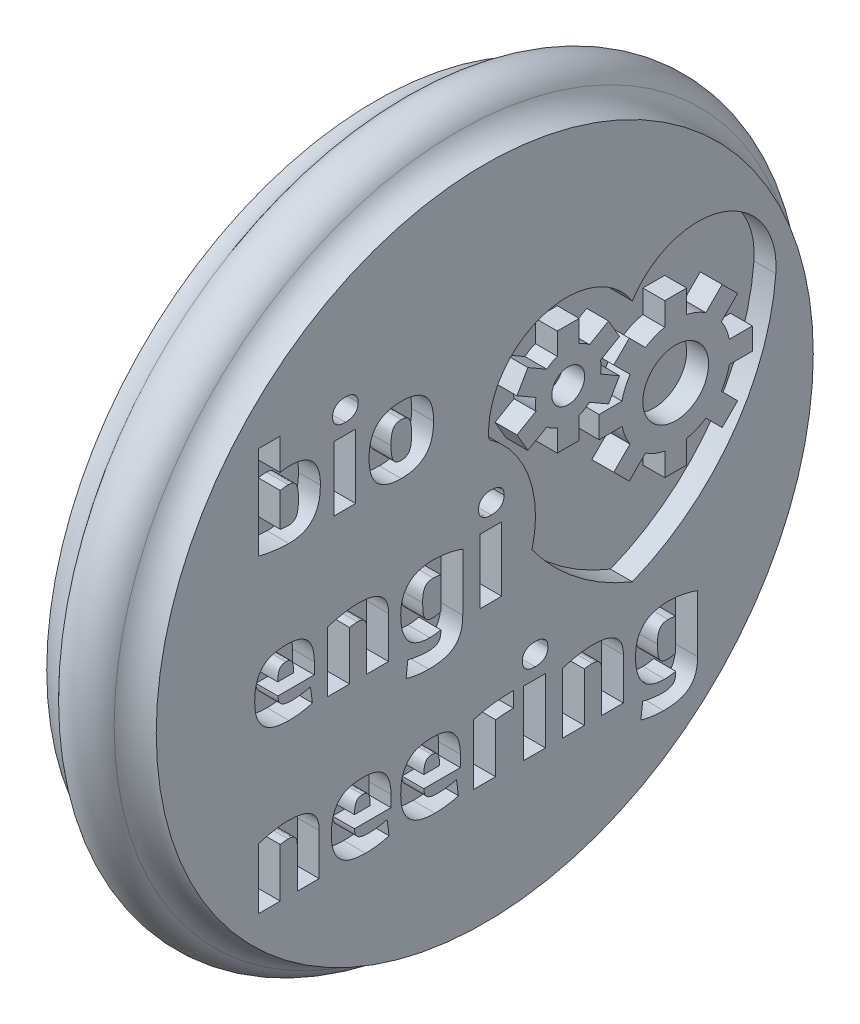
from build123d import *

# Parameters (mm, degrees)
SKETCH4_W           = 1.098925117
SKETCH4_H           = 1.442867679
SKETCH4_W_2         = 3.727396223
SKETCH4_H_2         = 4.327211873
CUT_EXTRUDE1_DEPTH  = 1
SKETCH5_W           = 1
SKETCH5_H           = 2.944444445
CUT_EXTRUDE2_DEPTH  = 1
CUT_EXTRUDE3_DEPTH  = 1
SKETCH12_R          = 1.5
SKETCH12_R_2        = 0.75
BOSS_EXTRUDE6_DEPTH = 1


with BuildPart() as part:
    # Sketch3 → Revolve1 (revolve)
    with BuildSketch(Plane.XY):
        with BuildLine():
            Line((2.5, 0), (2.5, 15))
            ThreePointArc((2.5, 15), (1.790681417, 15.178308982), (1.25, 15.670843802))
            ThreePointArc((1.25, 15.670843802), (0, 16.341687605), (-1.25, 15.670843802))
            ThreePointArc((-1.25, 15.670843802), (-1.790681417, 15.178308982), (-2.5, 15))
            Line((-2.5, 15), (-2.5, 0))
            Line((-2.5, 0), (2.5, 0))
        make_face()
    revolve(axis=Axis((-2.5, 0, 0), (1, 0, 0)))

    # Sketch4 → Cut-Extrude1 (cut)
    # profile 1 of 7: a face of its own
    with BuildSketch(Plane.ZY.offset(2.5)):
        Polygon((-10.653443, 2.733564563), (-9.578232551, 1.753928377), (-4.775625879, 1.753928377), (-4.775625879, 8.063920985), (-5.850836328, 8.063920985), (-5.850836328, 2.732988099), (-9.578232551, 2.732988099), (-9.578232551, 8.063920985), (-10.653443, 8.063920985), align=None)
    # profile 2 of 7: a face of its own
    with BuildSketch(Plane.ZY.offset(2.5)):
        Polygon((-2.923928472, 2.710878701), (-1.87361714, 1.753928377), (2.720938275, 1.753928377), (2.720938275, 2.732988099), (-1.825003355, 2.732988099), (-1.825003355, 8.063920985), (-2.923928472, 8.063920985), align=None)
    # profile 3 of 7: a face of its own
    with BuildSketch(Plane.ZY.offset(2.5)):
        with Locations((-2.374465913, 10.292120608)):
            Rectangle(SKETCH4_W, SKETCH4_H)
    # profile 4 of 7: a face of its own
    with BuildSketch(Plane.ZY.offset(2.5)):
        Polygon((5.246491774, 8.063920985), (4.197699102, 7.096005876), (4.197699102, 2.732988099), (5.246491774, 1.753928377), (10.053458187, 1.753928377), (10.053458187, 2.732988099), (5.246491774, 2.732988099), (5.246491774, 7.096005876), (10.053458187, 7.096005876), (10.053458187, 8.063920985), align=None)
    # profile 5 of 7: a face of its own
    with BuildSketch(Plane.ZY.offset(2.5)):
        Polygon((-2.090431232, -2.863271218), (-3.139223904, -3.831186327), (-3.139223904, -8.194204104), (-2.090431232, -9.173263826), (2.716535182, -9.173263826), (2.716535182, -8.194204104), (-2.090431232, -8.194204104), (-2.090431232, -3.831186327), (2.716535182, -3.831186327), (2.716535182, -2.863271218), align=None)
    # profile 6 of 7: a face of its own
    with BuildSketch(Plane.ZY.offset(2.5)):
        Polygon((-10.653443, 0.058805426), (-10.653443, -8.194204104), (-9.578232551, -9.186499785), (-5.850836328, -9.186499785), (-4.775625879, -8.194204104), (-4.775625879, -3.866992231), (-5.850836328, -2.863271218), (-9.578232551, -2.863271218), (-9.578232551, 0.058805426), align=None)
        with Locations((-7.71453444, -6.030598168)):
            Rectangle(SKETCH4_W_2, SKETCH4_H_2, mode=Mode.SUBTRACT)
    # profile 7 of 7: a face of its own
    with BuildSketch(Plane.ZY.offset(2.5)):
        Polygon((4.197699102, -9.173263826), (4.197699102, -2.860006343), (8.943177617, -2.860006343), (10.053458187, -3.888706099), (10.053458187, -9.173263826), (8.943177617, -9.173263826), (8.943177617, -3.834683562), (5.246491774, -3.834683562), (5.246491774, -9.173263826), align=None)
    extrude(amount=-CUT_EXTRUDE1_DEPTH, mode=Mode.SUBTRACT)

    # Sketch5 → Cut-Extrude2 (cut)
    # profile 1 of 17: a face of its own
    with BuildSketch(Plane(origin=(2.5, 0, 0), x_dir=(0, 0, -1), z_dir=(1, 0, 0))):
        with BuildLine():
            Line((-10.337588384, 8.922156578), (-9.337588384, 8.922156578))
            Line((-9.337588384, 8.922156578), (-9.337588384, 7.477712134))
            add(Edge.make_bspline(
                [(-9.337588384, 7.477712134), (-9.298964289, 7.48744329), (-9.223445394, 7.506469915), (-9.110466955, 7.52153216), (-9.004166714, 7.531931249), (-8.935412785, 7.532836756), (-8.90269255, 7.533267689)],
                knots=[0, 0, 0, 0, 1.086305912, 2.123975259, 3.107193275, 4, 4, 4, 4], degree=3))
            add(Edge.make_bspline(
                [(-8.90269255, 7.533267689), (-8.85115279, 7.53223284), (-8.750172238, 7.530205287), (-8.602161498, 7.515336691), (-8.461280439, 7.490525265), (-8.328011857, 7.454737076), (-8.202490824, 7.409752641), (-8.087019631, 7.35057429), (-7.980560387, 7.281364075), (-7.88382738, 7.199641045), (-7.797319028, 7.105260052), (-7.721423175, 6.99708561), (-7.655326253, 6.876090713), (-7.600710565, 6.741190681), (-7.557076432, 6.592384221), (-7.52668081, 6.428661976), (-7.507139347, 6.250175419), (-7.505240035, 6.126204813), (-7.50425505, 6.061913523)],
                knots=[0, 0, 0, 0, 1.062413166, 2.081559303, 3.063287522, 4.008168672, 4.923495522, 5.80653023, 6.676799162, 7.536060834, 8.410022333, 9.30873456, 10.25374751, 11.246290025, 12.30333065, 13.445168899, 14.675061812, 16, 16, 16, 16], degree=3))
            add(Edge.make_bspline(
                [(-7.50425505, 6.061913523), (-7.505579615, 5.990110888), (-7.508122157, 5.852283529), (-7.527581409, 5.654138874), (-7.562012912, 5.47399796), (-7.609625963, 5.31111191), (-7.669739493, 5.165230177), (-7.740130071, 5.035116033), (-7.820284963, 4.919586226), (-7.912274984, 4.820041005), (-8.013688719, 4.73482543), (-8.123282119, 4.661331769), (-8.242828036, 4.60292291), (-8.370318457, 4.555869489), (-8.504805902, 4.520905254), (-8.645815885, 4.49548351), (-8.793007267, 4.480869829), (-8.893401762, 4.478775272), (-8.944359217, 4.477712134)],
                knots=[0, 0, 0, 0, 1.403930105, 2.694886887, 3.887772941, 4.985218869, 6.007592305, 6.967164168, 7.872896562, 8.749823691, 9.609030312, 10.458004126, 11.323392237, 12.2041624, 13.111325164, 14.036933478, 15.00360199, 16, 16, 16, 16], degree=3))
            add(Edge.make_bspline(
                [(-8.944359217, 4.477712134), (-8.995590885, 4.478430216), (-9.105973889, 4.479977386), (-9.279659825, 4.492063961), (-9.466665139, 4.509846253), (-9.658223822, 4.534143509), (-9.847697456, 4.562814918), (-10.001324173, 4.588562447), (-10.117897914, 4.610618986), (-10.197150603, 4.62793487), (-10.269790635, 4.645326417), (-10.315621605, 4.657595468), (-10.337588384, 4.663476023)],
                knots=[0, 0, 0, 0, 1.091100635, 2.350869511, 3.706721632, 5.091825214, 6.462817498, 7.788042388, 8.409297916, 8.989521724, 9.515677869, 10, 10, 10, 10], degree=3))
            Line((-10.337588384, 4.663476023), (-10.337588384, 8.922156578))
        make_face()
        with BuildLine():
            add(Edge.make_bspline(
                [(-9.337588384, 5.234656578), (-9.303611557, 5.22622551), (-9.239108639, 5.210219646), (-9.141869541, 5.201142883), (-9.046793034, 5.200915657), (-8.983132048, 5.200267335), (-8.950435606, 5.199934356)],
                knots=[0, 0, 0, 0, 1.075453039, 2.041681479, 2.994202686, 4, 4, 4, 4], degree=3))
            add(Edge.make_bspline(
                [(-8.950435606, 5.199934356), (-8.931296392, 5.200303753), (-8.894250274, 5.201018762), (-8.840744171, 5.210264355), (-8.790971292, 5.223706453), (-8.745380647, 5.243559729), (-8.704936513, 5.270403314), (-8.668271243, 5.30194286), (-8.634705358, 5.338354716), (-8.606590196, 5.382322122), (-8.58226902, 5.433744312), (-8.56035338, 5.493735705), (-8.544028729, 5.563541036), (-8.52875734, 5.642216553), (-8.518373305, 5.730449931), (-8.509052889, 5.828227157), (-8.505520391, 5.935442689), (-8.504687494, 6.010119911), (-8.50425505, 6.048892689)],
                knots=[0, 0, 0, 0, 0.842586884, 1.630922394, 2.385956521, 3.111102466, 3.811489729, 4.516967418, 5.239304234, 5.985671972, 6.80704785, 7.743004524, 8.79466857, 9.962762233, 11.274121491, 12.70817321, 14.290867483, 16, 16, 16, 16], degree=3))
            add(Edge.make_bspline(
                [(-8.50425505, 6.048892689), (-8.504469739, 6.085651083), (-8.504879166, 6.155752109), (-8.511115837, 6.25537679), (-8.520403495, 6.344639269), (-8.533375001, 6.42407075), (-8.54945848, 6.495078363), (-8.570362835, 6.557763476), (-8.594422551, 6.612925527), (-8.622415171, 6.660445881), (-8.65375049, 6.700928143), (-8.688785579, 6.734397222), (-8.727412028, 6.761034959), (-8.784932523, 6.786463641), (-8.865702001, 6.807402327), (-8.93321079, 6.809790996), (-8.968664773, 6.811045467)],
                knots=[0, 0, 0, 0, 1.506420786, 2.872857869, 4.089603471, 5.183437479, 6.170181561, 7.070300655, 7.887960443, 8.632412688, 9.325189342, 9.979540774, 10.611140373, 11.237372174, 12.549134702, 14, 14, 14, 14], degree=3))
            add(Edge.make_bspline(
                [(-8.968664773, 6.811045467), (-8.999363852, 6.810655523), (-9.063218989, 6.809844427), (-9.158386304, 6.799327442), (-9.250894299, 6.787468509), (-9.30985947, 6.775755164), (-9.337588384, 6.770246856)],
                knots=[0, 0, 0, 0, 0.990421202, 2.060110025, 3.08774892, 4, 4, 4, 4], degree=3))
            Line((-9.337588384, 6.770246856), (-9.337588384, 5.234656578))
        make_face(mode=Mode.SUBTRACT)
    # profile 2 of 17: a face of its own
    with BuildSketch(Plane(origin=(2.5, 0, 0), x_dir=(0, 0, -1), z_dir=(1, 0, 0))):
        with Locations((-6.393143939, 6.005489912)):
            Rectangle(SKETCH5_W, SKETCH5_H)
    # profile 3 of 17: a face of its own
    with BuildSketch(Plane(origin=(2.5, 0, 0), x_dir=(0, 0, -1), z_dir=(1, 0, 0))):
        with BuildLine():
            add(Edge.make_bspline(
                [(-5.782032828, 8.477712134), (-5.783552626, 8.438723103), (-5.786438823, 8.364680353), (-5.816660044, 8.260891147), (-5.867153239, 8.17210043), (-5.938181967, 8.099853372), (-6.026096791, 8.045513574), (-6.126882484, 8.004706134), (-6.241956308, 7.98179058), (-6.323021074, 7.979111553), (-6.365366162, 7.977712134)],
                knots=[0, 0, 0, 0, 1.07085703, 2.03362835, 2.943486247, 3.855920171, 4.790540629, 5.769645667, 6.834949485, 8, 8, 8, 8], degree=3))
            add(Edge.make_bspline(
                [(-6.365366162, 7.977712134), (-6.407722598, 7.979070198), (-6.488525535, 7.981660962), (-6.603442561, 8.005044962), (-6.704468151, 8.045258602), (-6.792453059, 8.099923917), (-6.863798469, 8.171826707), (-6.912772268, 8.261324817), (-6.944662314, 8.364466405), (-6.947307933, 8.438677852), (-6.948699495, 8.477712134)],
                knots=[0, 0, 0, 0, 1.165354417, 2.223134589, 3.209887504, 4.144751756, 5.057423687, 5.963570093, 6.928863639, 8, 8, 8, 8], degree=3))
            add(Edge.make_bspline(
                [(-6.948699495, 8.477712134), (-6.947313869, 8.516752794), (-6.944679536, 8.590976368), (-6.912712785, 8.694035533), (-6.864107106, 8.783638975), (-6.79186726, 8.854481001), (-6.704806057, 8.910380095), (-6.603386244, 8.950299405), (-6.488541746, 8.973786304), (-6.407728173, 8.976361979), (-6.365366162, 8.977712134)],
                knots=[0, 0, 0, 0, 1.071321725, 2.036782319, 2.943085537, 3.850229027, 4.789557013, 5.776480689, 6.834443914, 8, 8, 8, 8], degree=3))
            add(Edge.make_bspline(
                [(-6.365366162, 8.977712134), (-6.323015497, 8.97632063), (-6.241940053, 8.973656757), (-6.126939105, 8.950637772), (-6.025760855, 8.910122101), (-5.938767636, 8.854551435), (-5.866841361, 8.783367524), (-5.816719244, 8.694469366), (-5.786421681, 8.590762374), (-5.783546713, 8.516707532), (-5.782032828, 8.477712134)],
                knots=[0, 0, 0, 0, 1.165252079, 2.230740203, 3.210014635, 4.149097621, 5.056004505, 5.966019815, 6.928957703, 8, 8, 8, 8], degree=3))
        make_face()
    # profile 4 of 17: a face of its own
    with BuildSketch(Plane(origin=(2.5, 0, 0), x_dir=(0, 0, -1), z_dir=(1, 0, 0))):
        with BuildLine():
            add(Edge.make_bspline(
                [(-2.337588384, 6.008094078), (-2.338743917, 5.943527498), (-2.340976538, 5.818777466), (-2.358368387, 5.638268138), (-2.387110484, 5.471419514), (-2.429035845, 5.318337952), (-2.481725443, 5.178411163), (-2.546443598, 5.05167943), (-2.624734146, 4.939548335), (-2.713665892, 4.840271838), (-2.815111621, 4.755103225), (-2.925617652, 4.679415497), (-3.048017952, 4.617504212), (-3.180194027, 4.565723995), (-3.32282441, 4.526393751), (-3.47577695, 4.497491047), (-3.639329899, 4.481464277), (-3.751906891, 4.478986548), (-3.809810606, 4.477712134)],
                knots=[0, 0, 0, 0, 1.269632928, 2.453076325, 3.562673934, 4.595313418, 5.569739376, 6.498723009, 7.385893869, 8.252158507, 9.111969315, 9.984788476, 10.880658811, 11.803206152, 12.772484006, 13.785893495, 14.861179454, 16, 16, 16, 16], degree=3))
            add(Edge.make_bspline(
                [(-3.809810606, 4.477712134), (-3.867714321, 4.478986548), (-3.980291313, 4.481464277), (-4.143844262, 4.497491047), (-4.296796802, 4.526393751), (-4.439427185, 4.565723995), (-4.57160326, 4.617504212), (-4.69400356, 4.679415497), (-4.804509591, 4.755103225), (-4.90595532, 4.840271838), (-4.994887066, 4.939548335), (-5.073177614, 5.05167943), (-5.137895769, 5.178411163), (-5.190585366, 5.318337952), (-5.232510728, 5.471419514), (-5.261252825, 5.638268138), (-5.278644673, 5.818777466), (-5.280877295, 5.943527498), (-5.282032828, 6.008094078)],
                knots=[0, 0, 0, 0, 1.138820546, 2.214106505, 3.227515994, 4.196793848, 5.119341189, 6.015211524, 6.888030685, 7.747841493, 8.614106131, 9.501276991, 10.430260624, 11.404686582, 12.437326066, 13.546923675, 14.730367072, 16, 16, 16, 16], degree=3))
            add(Edge.make_bspline(
                [(-5.282032828, 6.008094078), (-5.280867684, 6.072658662), (-5.278616493, 6.197404837), (-5.261381145, 6.377657102), (-5.23222726, 6.544411974), (-5.19090786, 6.69736749), (-5.137913973, 6.836960231), (-5.072889715, 6.962882476), (-4.995222969, 7.074925042), (-4.905556449, 7.173195138), (-4.805092316, 7.258746118), (-4.693412533, 7.332143627), (-4.571669802, 7.394399126), (-4.439552591, 7.446340029), (-4.296642026, 7.484301909), (-4.143867069, 7.513575313), (-3.980285068, 7.529491849), (-3.8677122, 7.531985226), (-3.809810606, 7.533267689)],
                knots=[0, 0, 0, 0, 1.27142463, 2.456538098, 3.562090667, 4.601684172, 5.572162569, 6.497399244, 7.385822077, 8.249087446, 9.110111616, 9.977823306, 10.87495789, 11.798807126, 12.767929347, 13.782768956, 14.859572354, 16, 16, 16, 16], degree=3))
            add(Edge.make_bspline(
                [(-3.809810606, 7.533267689), (-3.751909012, 7.531985226), (-3.639336144, 7.529491849), (-3.475754143, 7.513575313), (-3.322979186, 7.484301909), (-3.18006862, 7.446340029), (-3.04795141, 7.394399126), (-2.926208679, 7.332143627), (-2.814528896, 7.258746118), (-2.714064763, 7.173195138), (-2.624398242, 7.074925042), (-2.546731497, 6.962882476), (-2.481707239, 6.836960231), (-2.428713352, 6.69736749), (-2.387393952, 6.544411974), (-2.358240067, 6.377657102), (-2.341004719, 6.197404837), (-2.338753527, 6.072658662), (-2.337588384, 6.008094078)],
                knots=[0, 0, 0, 0, 1.140427646, 2.217231044, 3.232070653, 4.201192874, 5.12504211, 6.022176694, 6.889888384, 7.750912554, 8.614177923, 9.502600756, 10.427837431, 11.398315828, 12.437909333, 13.543461902, 14.72857537, 16, 16, 16, 16], degree=3))
        make_face()
        with BuildLine():
            add(Edge.make_bspline(
                [(-3.337588384, 6.008094078), (-3.337870213, 6.044271274), (-3.338411643, 6.113772494), (-3.343920057, 6.213639224), (-3.35136909, 6.304898921), (-3.362082799, 6.387663176), (-3.378116406, 6.46171458), (-3.395853673, 6.527380236), (-3.416368321, 6.585104373), (-3.441946788, 6.634114847), (-3.470695456, 6.677023521), (-3.505286497, 6.713075488), (-3.544276106, 6.743319887), (-3.588002519, 6.768427534), (-3.636710233, 6.787087551), (-3.690268614, 6.800974694), (-3.74846049, 6.809897036), (-3.788943558, 6.81065485), (-3.809810606, 6.811045467)],
                knots=[0, 0, 0, 0, 1.625110318, 3.122053752, 4.491976529, 5.738411145, 6.867848025, 7.89280984, 8.793515942, 9.613291655, 10.370489173, 11.106065791, 11.84713528, 12.580756644, 13.362873305, 14.182649018, 15.063244151, 16, 16, 16, 16], degree=3))
            add(Edge.make_bspline(
                [(-3.809810606, 6.811045467), (-3.830679723, 6.810659589), (-3.871166804, 6.809910966), (-3.929330609, 6.80092433), (-3.9827246, 6.787325412), (-4.031098674, 6.767957323), (-4.075225792, 6.743625036), (-4.114313203, 6.713035626), (-4.148932616, 6.677034669), (-4.17766864, 6.634110827), (-4.203270645, 6.585108701), (-4.223691992, 6.527365309), (-4.241827086, 6.461836425), (-4.25606715, 6.387455541), (-4.268701923, 6.305010658), (-4.27556296, 6.21361752), (-4.28124897, 6.113778682), (-4.281764488, 6.044273392), (-4.282032828, 6.008094078)],
                knots=[0, 0, 0, 0, 0.936847332, 1.817528464, 2.637384236, 3.407491725, 4.152500242, 4.893642102, 5.629290557, 6.386562022, 7.206417794, 8.107211859, 9.132273771, 10.259199406, 11.507584787, 12.87764135, 14.374730975, 16, 16, 16, 16], degree=3))
            add(Edge.make_bspline(
                [(-4.282032828, 6.008094078), (-4.281763009, 5.97191493), (-4.281244649, 5.90240996), (-4.275578115, 5.802568931), (-4.268630587, 5.710897463), (-4.256133587, 5.628149101), (-4.241894585, 5.55345789), (-4.223303337, 5.48751735), (-4.203671524, 5.428910452), (-4.177668124, 5.379457278), (-4.148699287, 5.336469637), (-4.114338401, 5.299759243), (-4.075520885, 5.268089536), (-4.030864205, 5.244142697), (-3.982957156, 5.22338306), (-3.92929338, 5.210143547), (-3.871177101, 5.201044502), (-3.830683225, 5.20031195), (-3.809810606, 5.199934356)],
                knots=[0, 0, 0, 0, 1.619222664, 3.110742783, 4.475702432, 5.732258691, 6.854991913, 7.876240367, 8.798027631, 9.614833357, 10.369287605, 11.111637524, 11.85804403, 12.600280949, 13.372427419, 14.189233145, 15.066637948, 16, 16, 16, 16], degree=3))
            add(Edge.make_bspline(
                [(-3.809810606, 5.199934356), (-3.788940154, 5.200316787), (-3.748450483, 5.201058722), (-3.690304795, 5.210092135), (-3.636482279, 5.223622638), (-3.588230696, 5.243666014), (-3.543985022, 5.268400655), (-3.50526085, 5.299718629), (-3.470928838, 5.336480844), (-3.441947317, 5.379453264), (-3.415967609, 5.428914837), (-3.39624031, 5.487502038), (-3.378047162, 5.553579312), (-3.362014892, 5.627941833), (-3.351437628, 5.711007898), (-3.343906316, 5.802547585), (-3.338415561, 5.902416046), (-3.337871554, 5.971917014), (-3.337588384, 6.008094078)],
                knots=[0, 0, 0, 0, 0.933274555, 1.810597105, 2.627326261, 3.411364516, 4.142259501, 4.888596036, 5.630876363, 6.385259885, 7.201989041, 8.123689892, 9.14484261, 10.270082129, 11.52471714, 12.889548831, 14.380929129, 16, 16, 16, 16], degree=3))
        make_face(mode=Mode.SUBTRACT)
    # profile 5 of 17: a face of its own
    with BuildSketch(Plane(origin=(2.5, 0, 0), x_dir=(0, 0, -1), z_dir=(1, 0, 0))):
        with BuildLine():
            add(Edge.make_bspline(
                [(-9.448699495, -1.300065644), (-9.447345829, -1.323540864), (-9.444745308, -1.368638991), (-9.434945668, -1.432700485), (-9.422431298, -1.490408288), (-9.399896569, -1.557018657), (-9.35789442, -1.629108989), (-9.300083907, -1.687618626), (-9.244725331, -1.72345718), (-9.196591235, -1.744706072), (-9.144148581, -1.764351669), (-9.084812141, -1.777654665), (-9.019585388, -1.788107411), (-8.947067591, -1.794608468), (-8.867156749, -1.799014148), (-8.811264376, -1.799704561), (-8.782032828, -1.800065644)],
                knots=[0, 0, 0, 0, 1.02292781, 1.965141472, 2.817558055, 3.590232504, 5.018054268, 6.407307271, 7.126944026, 7.876380295, 8.693065605, 9.560606292, 10.517187871, 11.567353641, 12.727733042, 14, 14, 14, 14], degree=3))
            add(Edge.make_bspline(
                [(-8.782032828, -1.800065644), (-8.749909757, -1.799365507), (-8.681857439, -1.797882274), (-8.575539522, -1.792027106), (-8.463490815, -1.780805191), (-8.350300056, -1.765300544), (-8.240775799, -1.745985542), (-8.137319482, -1.726495484), (-8.043981706, -1.706095651), (-7.986512355, -1.688428994), (-7.959984217, -1.680273977)],
                knots=[0, 0, 0, 0, 0.925454484, 1.960563549, 3.06602468, 4.168087482, 5.250531194, 6.268862006, 7.200898114, 8, 8, 8, 8], degree=3))
            Line((-7.959984217, -1.680273977), (-7.869706439, -2.366905922))
            add(Edge.make_bspline(
                [(-7.869706439, -2.366905922), (-7.905181655, -2.378296647), (-7.979019871, -2.402005334), (-8.096533887, -2.43097353), (-8.224348136, -2.456696128), (-8.408149494, -2.488081924), (-8.64815583, -2.515542032), (-8.84271307, -2.520025501), (-8.940886995, -2.522287866)],
                knots=[0, 0, 0, 0, 0.617159074, 1.284556681, 2.003798042, 2.776953329, 4.373645001, 6, 6, 6, 6], degree=3))
            add(Edge.make_bspline(
                [(-8.940886995, -2.522287866), (-8.995893819, -2.521510414), (-9.104040183, -2.519981902), (-9.263081222, -2.506276092), (-9.416301717, -2.486137778), (-9.562693824, -2.456051772), (-9.701564249, -2.415945655), (-9.831228598, -2.362087762), (-9.950429473, -2.293613644), (-10.061368121, -2.213681997), (-10.160819087, -2.118103219), (-10.249497313, -2.007847261), (-10.324648875, -1.881032848), (-10.390806146, -1.739742785), (-10.441646099, -1.579566267), (-10.478677862, -1.40105012), (-10.499786668, -1.202766715), (-10.502721052, -1.06429457), (-10.50425505, -0.991905922)],
                knots=[0, 0, 0, 0, 1.045356137, 2.055226173, 3.032179446, 3.981398479, 4.893299528, 5.775834848, 6.642896054, 7.500961932, 8.368441688, 9.256597493, 10.181917441, 11.163766128, 12.216044273, 13.36807473, 14.624116715, 16, 16, 16, 16], degree=3))
            add(Edge.make_bspline(
                [(-10.50425505, -0.991905922), (-10.502866678, -0.920396195), (-10.50020823, -0.783469685), (-10.481778495, -0.587695161), (-10.44923502, -0.411223884), (-10.403208063, -0.253255585), (-10.344865824, -0.112537115), (-10.275843252, 0.012954366), (-10.196826824, 0.124181924), (-10.106533079, 0.220748258), (-10.005602905, 0.303033524), (-9.894613653, 0.372182481), (-9.773105723, 0.427084153), (-9.641487031, 0.467111074), (-9.501731971, 0.497289472), (-9.353384123, 0.517410894), (-9.196927318, 0.531019854), (-9.089644637, 0.532505795), (-9.034636995, 0.533267689)],
                knots=[0, 0, 0, 0, 1.399123505, 2.679035524, 3.842718024, 4.905045149, 5.89232355, 6.817246834, 7.701782432, 8.554942325, 9.395841687, 10.242609649, 11.106614478, 11.99655096, 12.929341962, 13.901340697, 14.92394281, 16, 16, 16, 16], degree=3))
            add(Edge.make_bspline(
                [(-9.034636995, 0.533267689), (-8.979615998, 0.532410771), (-8.873645356, 0.530760342), (-8.721439871, 0.514260501), (-8.582101647, 0.48685713), (-8.455584141, 0.447734098), (-8.34079364, 0.398534056), (-8.238432546, 0.33767153), (-8.145899966, 0.268569039), (-8.066536287, 0.186582922), (-7.998331082, 0.095389397), (-7.936779111, -0.002987857), (-7.889544775, -0.112469087), (-7.848879312, -0.229209709), (-7.819262029, -0.354399496), (-7.797428906, -0.487511052), (-7.784426289, -0.628510255), (-7.782842295, -0.725385796), (-7.782032828, -0.774892033)],
                knots=[0, 0, 0, 0, 1.26751287, 2.441234471, 3.522672138, 4.534992108, 5.487577333, 6.393269318, 7.273443717, 8.141026287, 9.011856852, 9.894679156, 10.807972581, 11.752637229, 12.740754284, 13.767876344, 14.859319485, 16, 16, 16, 16], degree=3))
            Line((-7.782032828, -0.774892033), (-7.782032828, -1.300065644))
            Line((-7.782032828, -1.300065644), (-9.448699495, -1.300065644))
        make_face()
        with BuildLine():
            add(Edge.make_bspline(
                [(-8.726477273, -0.744510089), (-8.727143833, -0.695278434), (-8.728385615, -0.603561284), (-8.741397006, -0.476740826), (-8.76061751, -0.370184858), (-8.78683064, -0.295582491), (-8.81265267, -0.245800955), (-8.838054435, -0.216098199), (-8.866414621, -0.189676022), (-8.900213845, -0.168401713), (-8.939149517, -0.152979566), (-8.982635511, -0.141933942), (-9.030654624, -0.134929361), (-9.064125794, -0.133922157), (-9.081511995, -0.133398977)],
                knots=[0, 0, 0, 0, 2.177138421, 4.055945937, 5.635061372, 6.955133575, 7.539517439, 8.103350092, 8.674258909, 9.249599537, 9.858159781, 10.519498037, 11.230970855, 12, 12, 12, 12], degree=3))
            add(Edge.make_bspline(
                [(-9.081511995, -0.133398977), (-9.114475561, -0.134859236), (-9.176461569, -0.137605165), (-9.261330821, -0.167761597), (-9.329292357, -0.218247886), (-9.377284959, -0.290432696), (-9.408439301, -0.379922092), (-9.43280555, -0.485268448), (-9.445682569, -0.609077711), (-9.447648299, -0.697320992), (-9.448699495, -0.744510089)],
                knots=[0, 0, 0, 0, 0.968976907, 1.822102913, 2.614128074, 3.4237984, 4.336809153, 5.39679375, 6.607905878, 8, 8, 8, 8], degree=3))
            Line((-9.448699495, -0.744510089), (-8.726477273, -0.744510089))
        make_face(mode=Mode.SUBTRACT)
    # profile 6 of 17: a face of its own
    with BuildSketch(Plane(origin=(2.5, 0, 0), x_dir=(0, 0, -1), z_dir=(1, 0, 0))):
        with BuildLine():
            add(Edge.make_bspline(
                [(-7.170921717, 0.2928163), (-7.13136899, 0.305837044), (-7.045525757, 0.334096605), (-6.90547058, 0.372967509), (-6.747822041, 0.41396178), (-6.574328497, 0.450857001), (-6.389083569, 0.483672871), (-6.194885493, 0.510423248), (-5.995668816, 0.529902647), (-5.861361436, 0.532145762), (-5.794185606, 0.533267689)],
                knots=[0, 0, 0, 0, 0.712210085, 1.545744652, 2.48571352, 3.498255513, 4.578914134, 5.703095619, 6.85116917, 8, 8, 8, 8], degree=3))
            add(Edge.make_bspline(
                [(-5.794185606, 0.533267689), (-5.741796994, 0.53261826), (-5.639804559, 0.531353924), (-5.490807129, 0.521050599), (-5.350258173, 0.502847547), (-5.217666708, 0.477863295), (-5.093396372, 0.445569415), (-4.978309332, 0.403410589), (-4.871526569, 0.354492197), (-4.774463174, 0.295075487), (-4.687161079, 0.226231521), (-4.609101586, 0.147560196), (-4.544569273, 0.056207073), (-4.488956247, -0.044508917), (-4.445457901, -0.156849185), (-4.414403681, -0.280994637), (-4.396337456, -0.417299638), (-4.394235688, -0.512104615), (-4.393143939, -0.561350366)],
                knots=[0, 0, 0, 0, 1.23372439, 2.401868429, 3.515052937, 4.569539307, 5.577830998, 6.534970146, 7.452601788, 8.339664526, 9.208104754, 10.065865104, 10.93963618, 11.833192665, 12.769633936, 13.76790483, 14.840554517, 16, 16, 16, 16], degree=3))
            Line((-4.393143939, -0.561350366), (-4.393143939, -2.466732311))
            Line((-4.393143939, -2.466732311), (-5.393143939, -2.466732311))
            Line((-5.393143939, -2.466732311), (-5.393143939, -0.616905922))
            add(Edge.make_bspline(
                [(-5.393143939, -0.616905922), (-5.394158378, -0.578587268), (-5.396030673, -0.507864558), (-5.417136955, -0.411176482), (-5.453112477, -0.333180312), (-5.506167745, -0.275979949), (-5.5702884, -0.236677779), (-5.642790051, -0.209070197), (-5.724168021, -0.191127968), (-5.781642913, -0.189698352), (-5.811546717, -0.188954533)],
                knots=[0, 0, 0, 0, 1.329407516, 2.453617065, 3.41575158, 4.276604387, 5.121639732, 6.006516643, 6.962803863, 8, 8, 8, 8], degree=3))
            add(Edge.make_bspline(
                [(-5.811546717, -0.188954533), (-5.841089706, -0.189368295), (-5.904078532, -0.190250481), (-5.998609035, -0.200939655), (-6.089450544, -0.211318872), (-6.145828071, -0.224675959), (-6.170921717, -0.2306212)],
                knots=[0, 0, 0, 0, 0.977346078, 2.083806797, 3.147102122, 4, 4, 4, 4], degree=3))
            Line((-6.170921717, -0.2306212), (-6.170921717, -2.466732311))
            Line((-6.170921717, -2.466732311), (-7.170921717, -2.466732311))
            Line((-7.170921717, -2.466732311), (-7.170921717, 0.2928163))
        make_face()
    # profile 7 of 17: a face of its own
    with BuildSketch(Plane(origin=(2.5, 0, 0), x_dir=(0, 0, -1), z_dir=(1, 0, 0))):
        with BuildLine():
            add(Edge.make_bspline(
                [(-1.00425505, -2.3321837), (-1.005271686, -2.398525844), (-1.007213945, -2.525270996), (-1.030372677, -2.705677111), (-1.065646127, -2.867899672), (-1.117312194, -3.011328973), (-1.180980507, -3.138351969), (-1.257355536, -3.249246723), (-1.343521252, -3.347264974), (-1.44271153, -3.429383644), (-1.552704241, -3.496545631), (-1.670667198, -3.555275897), (-1.799721203, -3.599266053), (-1.937128582, -3.633904186), (-2.082361704, -3.658573418), (-2.234289074, -3.675198082), (-2.392659442, -3.687387361), (-2.500468926, -3.688425105), (-2.555470328, -3.688954533)],
                knots=[0, 0, 0, 0, 1.333913338, 2.548410973, 3.6527748, 4.667386169, 5.60723098, 6.503385978, 7.369229631, 8.224895913, 9.082619184, 9.957399232, 10.870598264, 11.81939683, 12.806119478, 13.83149555, 14.893689318, 16, 16, 16, 16], degree=3))
            add(Edge.make_bspline(
                [(-2.555470328, -3.688954533), (-2.605823519, -3.688096805), (-2.707177345, -3.686370321), (-2.858743368, -3.678335645), (-3.007627124, -3.661663453), (-3.150670159, -3.64406609), (-3.283257294, -3.618970228), (-3.402802784, -3.594067873), (-3.5048989, -3.566697605), (-3.566241842, -3.546805494), (-3.593664773, -3.537912866)],
                knots=[0, 0, 0, 0, 1.147594699, 2.309945224, 3.456800939, 4.560914042, 5.592980353, 6.530598219, 7.343114286, 8, 8, 8, 8], degree=3))
            Line((-3.593664773, -3.537912866), (-3.509463384, -2.833919811))
            add(Edge.make_bspline(
                [(-3.509463384, -2.833919811), (-3.48262595, -2.842270644), (-3.423619796, -2.860631211), (-3.326611408, -2.884457139), (-3.216287993, -2.904918972), (-3.097480841, -2.925345207), (-2.973428973, -2.940956616), (-2.84739013, -2.955542634), (-2.721964646, -2.964199729), (-2.638815202, -2.965898531), (-2.59800505, -2.966732311)],
                knots=[0, 0, 0, 0, 0.730002023, 1.605019779, 2.592651464, 3.64419642, 4.735911974, 5.839849134, 6.939787436, 8, 8, 8, 8], degree=3))
            add(Edge.make_bspline(
                [(-2.59800505, -2.966732311), (-2.552768119, -2.965918119), (-2.467288414, -2.964379622), (-2.347832852, -2.94384533), (-2.244108697, -2.913723695), (-2.169725351, -2.875642932), (-2.120331041, -2.836363119), (-2.088727073, -2.801313138), (-2.062735535, -2.759662893), (-2.040769162, -2.712534678), (-2.024886934, -2.659207964), (-2.012349767, -2.600339179), (-2.005910669, -2.53544977), (-2.004820004, -2.490181043), (-2.00425505, -2.466732311)],
                knots=[0, 0, 0, 0, 1.803619248, 3.408118919, 4.821996652, 6.10337454, 6.711262254, 7.332821828, 7.976833654, 8.664133813, 9.402071994, 10.192638261, 11.063805326, 12, 12, 12, 12], degree=3))
            Line((-2.00425505, -2.466732311), (-2.00425505, -2.406836477))
            add(Edge.make_bspline(
                [(-2.00425505, -2.406836477), (-2.042098076, -2.414700941), (-2.123500751, -2.431617886), (-2.250071597, -2.450356478), (-2.378405729, -2.463761406), (-2.46284912, -2.465782732), (-2.502518939, -2.466732311)],
                knots=[0, 0, 0, 0, 0.92249324, 1.984339675, 3.053083035, 4, 4, 4, 4], degree=3))
            add(Edge.make_bspline(
                [(-2.502518939, -2.466732311), (-2.549446031, -2.466134042), (-2.641520247, -2.464960197), (-2.776782755, -2.448733907), (-2.907104211, -2.427378853), (-3.03166281, -2.394400851), (-3.14950709, -2.350316919), (-3.259931811, -2.293636996), (-3.362112257, -2.22348039), (-3.456702087, -2.140798883), (-3.541654556, -2.042851838), (-3.617652855, -1.930309208), (-3.681961276, -1.801346793), (-3.739163345, -1.658051306), (-3.78463698, -1.497069255), (-3.814042658, -1.317407818), (-3.835140799, -1.119717608), (-3.836749006, -0.981553266), (-3.837588384, -0.909440644)],
                knots=[0, 0, 0, 0, 0.956241442, 1.876212145, 2.774395561, 3.647363772, 4.49879333, 5.335271522, 6.171499994, 7.020124445, 7.889836829, 8.807837896, 9.781484845, 10.822297497, 11.950400836, 13.18420281, 14.530340644, 16, 16, 16, 16], degree=3))
            add(Edge.make_bspline(
                [(-3.837588384, -0.909440644), (-3.836331404, -0.844861509), (-3.833911761, -0.720548872), (-3.813445538, -0.541975594), (-3.777876566, -0.379483909), (-3.729367888, -0.232041341), (-3.667461532, -0.099400579), (-3.594345835, 0.019488909), (-3.510336007, 0.124994219), (-3.415079365, 0.216806309), (-3.308863359, 0.295092528), (-3.19399582, 0.362244419), (-3.06953941, 0.417155375), (-2.936676571, 0.459940795), (-2.796651324, 0.492796269), (-2.650663196, 0.515614499), (-2.499390032, 0.531360244), (-2.396657596, 0.532625645), (-2.344532828, 0.533267689)],
                knots=[0, 0, 0, 0, 1.302961138, 2.508155837, 3.620304896, 4.654340144, 5.633938263, 6.567321002, 7.464647487, 8.348382261, 9.228928355, 10.121244304, 11.028339721, 11.968220226, 12.934148864, 13.92770887, 14.948553188, 16, 16, 16, 16], degree=3))
            add(Edge.make_bspline(
                [(-2.344532828, 0.533267689), (-2.285475487, 0.532508177), (-2.166908696, 0.530983337), (-1.989075405, 0.516187548), (-1.810794613, 0.49418895), (-1.634395373, 0.46150585), (-1.463041903, 0.423949168), (-1.300375057, 0.382116032), (-1.147951747, 0.33779317), (-1.051257213, 0.302854946), (-1.00425505, 0.285871856)],
                knots=[0, 0, 0, 0, 1.034711211, 2.077343582, 3.125141671, 4.181407966, 5.219777843, 6.198717121, 7.124415964, 8, 8, 8, 8], degree=3))
            Line((-1.00425505, 0.285871856), (-1.00425505, -2.3321837))
        make_face()
        with BuildLine():
            add(Edge.make_bspline(
                [(-2.00425505, -0.229753144), (-2.030834858, -0.224310652), (-2.08524447, -0.213169719), (-2.168955844, -0.200674889), (-2.255433176, -0.189859465), (-2.314115154, -0.189257603), (-2.343664773, -0.188954533)],
                knots=[0, 0, 0, 0, 0.950405523, 1.945506719, 2.965449103, 4, 4, 4, 4], degree=3))
            add(Edge.make_bspline(
                [(-2.343664773, -0.188954533), (-2.379622335, -0.190319858), (-2.448950169, -0.192952267), (-2.532960682, -0.209176932), (-2.593816263, -0.230912361), (-2.634698292, -0.254312664), (-2.672313059, -0.283732693), (-2.705460464, -0.321112257), (-2.735347021, -0.3651025), (-2.76118126, -0.417267439), (-2.784698982, -0.476932991), (-2.803466953, -0.54568772), (-2.819223363, -0.623635954), (-2.830335801, -0.712399599), (-2.835777869, -0.812439466), (-2.836964037, -0.8828148), (-2.837588384, -0.919857311)],
                knots=[0, 0, 0, 0, 1.478050052, 2.849748532, 3.497126657, 4.125652588, 4.777712845, 5.45143786, 6.170669173, 6.957990688, 7.839347297, 8.803358464, 9.883450648, 11.106558091, 12.477018203, 14, 14, 14, 14], degree=3))
            add(Edge.make_bspline(
                [(-2.837588384, -0.919857311), (-2.837220663, -0.958924337), (-2.836514946, -1.033900369), (-2.832173601, -1.141006477), (-2.825626392, -1.237765923), (-2.815525671, -1.323893454), (-2.801404362, -1.400369493), (-2.784998719, -1.468131226), (-2.762799564, -1.526508804), (-2.738937509, -1.577256616), (-2.709523127, -1.619649998), (-2.676628947, -1.655857956), (-2.638646754, -1.684609084), (-2.582354507, -1.715804733), (-2.498796789, -1.739801794), (-2.428612129, -1.742878926), (-2.391407828, -1.744510089)],
                knots=[0, 0, 0, 0, 1.526141773, 2.928916452, 4.186860901, 5.314099499, 6.31399734, 7.22419342, 8.032532953, 8.750372811, 9.408796408, 10.040682023, 10.653369993, 11.260506526, 12.547817423, 14, 14, 14, 14], degree=3))
            add(Edge.make_bspline(
                [(-2.391407828, -1.744510089), (-2.358379793, -1.744003507), (-2.294430413, -1.743022657), (-2.199331295, -1.730587217), (-2.10322818, -1.711727078), (-2.038319668, -1.695084535), (-2.00425505, -1.686350366)],
                knots=[0, 0, 0, 0, 1.008581431, 1.952830545, 2.925625563, 4, 4, 4, 4], degree=3))
            Line((-2.00425505, -1.686350366), (-2.00425505, -0.229753144))
        make_face(mode=Mode.SUBTRACT)
    # profile 8 of 17: a face of its own
    with BuildSketch(Plane(origin=(2.5, 0, 0), x_dir=(0, 0, -1), z_dir=(1, 0, 0))):
        with Locations((0.273522727, -0.994510089)):
            Rectangle(SKETCH5_W, SKETCH5_H)
    # profile 9 of 17: a face of its own
    with BuildSketch(Plane(origin=(2.5, 0, 0), x_dir=(0, 0, -1), z_dir=(1, 0, 0))):
        with BuildLine():
            add(Edge.make_bspline(
                [(0.884633838, 1.477712134), (0.883114041, 1.438723103), (0.880227844, 1.364680353), (0.850006622, 1.260891147), (0.799513427, 1.17210043), (0.728484699, 1.099853372), (0.640569876, 1.045513574), (0.539784183, 1.004706134), (0.424710359, 0.98179058), (0.343645592, 0.979111553), (0.301300505, 0.977712134)],
                knots=[0, 0, 0, 0, 1.07085703, 2.03362835, 2.943486247, 3.855920171, 4.790540629, 5.769645667, 6.834949485, 8, 8, 8, 8], degree=3))
            add(Edge.make_bspline(
                [(0.301300505, 0.977712134), (0.258944069, 0.979070198), (0.178141132, 0.981660962), (0.063224105, 1.005044962), (-0.037801484, 1.045258602), (-0.125786392, 1.099923917), (-0.197131802, 1.171826707), (-0.246105602, 1.261324817), (-0.277995647, 1.364466405), (-0.280641266, 1.438677852), (-0.282032828, 1.477712134)],
                knots=[0, 0, 0, 0, 1.165354417, 2.223134589, 3.209887504, 4.144751756, 5.057423687, 5.963570093, 6.928863639, 8, 8, 8, 8], degree=3))
            add(Edge.make_bspline(
                [(-0.282032828, 1.477712134), (-0.280647202, 1.516752794), (-0.278012869, 1.590976368), (-0.246046118, 1.694035533), (-0.19744044, 1.783638975), (-0.125200594, 1.854481001), (-0.03813939, 1.910380095), (0.063280423, 1.950299405), (0.178124921, 1.973786304), (0.258938493, 1.976361979), (0.301300505, 1.977712134)],
                knots=[0, 0, 0, 0, 1.071321725, 2.036782319, 2.943085537, 3.850229027, 4.789557013, 5.776480689, 6.834443914, 8, 8, 8, 8], degree=3))
            add(Edge.make_bspline(
                [(0.301300505, 1.977712134), (0.34365117, 1.97632063), (0.424726614, 1.973656757), (0.539727562, 1.950637772), (0.640905811, 1.910122101), (0.727899031, 1.854551435), (0.799825305, 1.783367524), (0.849947423, 1.694469366), (0.880244985, 1.590762374), (0.883119953, 1.516707532), (0.884633838, 1.477712134)],
                knots=[0, 0, 0, 0, 1.165252079, 2.230740203, 3.210014635, 4.149097621, 5.056004505, 5.966019815, 6.928957703, 8, 8, 8, 8], degree=3))
        make_face()
    # profile 10 of 17: a face of its own
    with BuildSketch(Plane(origin=(2.5, 0, 0), x_dir=(0, 0, -1), z_dir=(1, 0, 0))):
        with BuildLine():
            add(Edge.make_bspline(
                [(-10.337588384, -6.7071837), (-10.298035657, -6.694162956), (-10.212192424, -6.665903395), (-10.072137247, -6.627032491), (-9.914488708, -6.58603822), (-9.740995164, -6.549142999), (-9.555750236, -6.516327129), (-9.36155216, -6.489576752), (-9.162335482, -6.470097353), (-9.028028103, -6.467854238), (-8.960852273, -6.466732311)],
                knots=[0, 0, 0, 0, 0.712210085, 1.545744652, 2.48571352, 3.498255513, 4.578914134, 5.703095619, 6.85116917, 8, 8, 8, 8], degree=3))
            add(Edge.make_bspline(
                [(-8.960852273, -6.466732311), (-8.90846366, -6.46738174), (-8.806471226, -6.468646076), (-8.657473795, -6.478949401), (-8.516924839, -6.497152453), (-8.384333374, -6.522136705), (-8.260063039, -6.554430585), (-8.144975998, -6.596589411), (-8.038193235, -6.645507803), (-7.94112984, -6.704924513), (-7.853827745, -6.773768479), (-7.775768253, -6.852439804), (-7.71123594, -6.943792927), (-7.655622913, -7.044508917), (-7.612124568, -7.156849185), (-7.581070348, -7.280994637), (-7.563004123, -7.417299638), (-7.560902354, -7.512104615), (-7.559810606, -7.561350366)],
                knots=[0, 0, 0, 0, 1.23372439, 2.401868429, 3.515052937, 4.569539307, 5.577830998, 6.534970146, 7.452601788, 8.339664526, 9.208104754, 10.065865104, 10.93963618, 11.833192665, 12.769633936, 13.76790483, 14.840554517, 16, 16, 16, 16], degree=3))
            Line((-7.559810606, -7.561350366), (-7.559810606, -9.466732311))
            Line((-7.559810606, -9.466732311), (-8.559810606, -9.466732311))
            Line((-8.559810606, -9.466732311), (-8.559810606, -7.616905922))
            add(Edge.make_bspline(
                [(-8.559810606, -7.616905922), (-8.560825044, -7.578587268), (-8.562697339, -7.507864558), (-8.583803622, -7.411176482), (-8.619779144, -7.333180312), (-8.672834411, -7.275979949), (-8.736955066, -7.236677779), (-8.809456718, -7.209070197), (-8.890834688, -7.191127968), (-8.94830958, -7.189698352), (-8.978213384, -7.188954533)],
                knots=[0, 0, 0, 0, 1.329407516, 2.453617065, 3.41575158, 4.276604387, 5.121639732, 6.006516643, 6.962803863, 8, 8, 8, 8], degree=3))
            add(Edge.make_bspline(
                [(-8.978213384, -7.188954533), (-9.007756373, -7.189368295), (-9.070745199, -7.190250481), (-9.165275702, -7.200939655), (-9.256117211, -7.211318872), (-9.312494738, -7.224675959), (-9.337588384, -7.2306212)],
                knots=[0, 0, 0, 0, 0.977346078, 2.083806797, 3.147102122, 4, 4, 4, 4], degree=3))
            Line((-9.337588384, -7.2306212), (-9.337588384, -9.466732311))
            Line((-9.337588384, -9.466732311), (-10.337588384, -9.466732311))
            Line((-10.337588384, -9.466732311), (-10.337588384, -6.7071837))
        make_face()
    # profile 11 of 17: a face of its own
    with BuildSketch(Plane(origin=(2.5, 0, 0), x_dir=(0, 0, -1), z_dir=(1, 0, 0))):
        with BuildLine():
            add(Edge.make_bspline(
                [(-5.948699495, -8.300065644), (-5.947345829, -8.323540864), (-5.944745308, -8.368638991), (-5.934945668, -8.432700485), (-5.922431298, -8.490408288), (-5.899896569, -8.557018657), (-5.85789442, -8.629108989), (-5.800083907, -8.687618626), (-5.744725331, -8.72345718), (-5.696591235, -8.744706072), (-5.644148581, -8.764351669), (-5.584812141, -8.777654665), (-5.519585388, -8.788107411), (-5.447067591, -8.794608468), (-5.367156749, -8.799014148), (-5.311264376, -8.799704561), (-5.282032828, -8.800065644)],
                knots=[0, 0, 0, 0, 1.02292781, 1.965141472, 2.817558055, 3.590232504, 5.018054268, 6.407307271, 7.126944026, 7.876380295, 8.693065605, 9.560606292, 10.517187871, 11.567353641, 12.727733042, 14, 14, 14, 14], degree=3))
            add(Edge.make_bspline(
                [(-5.282032828, -8.800065644), (-5.249909757, -8.799365507), (-5.181857439, -8.797882274), (-5.075539522, -8.792027106), (-4.963490815, -8.780805191), (-4.850300056, -8.765300544), (-4.740775799, -8.745985542), (-4.637319482, -8.726495484), (-4.543981706, -8.706095651), (-4.486512355, -8.688428994), (-4.459984217, -8.680273977)],
                knots=[0, 0, 0, 0, 0.925454484, 1.960563549, 3.06602468, 4.168087482, 5.250531194, 6.268862006, 7.200898114, 8, 8, 8, 8], degree=3))
            Line((-4.459984217, -8.680273977), (-4.369706439, -9.366905922))
            add(Edge.make_bspline(
                [(-4.369706439, -9.366905922), (-4.405181655, -9.378296647), (-4.479019871, -9.402005334), (-4.596533887, -9.43097353), (-4.724348136, -9.456696128), (-4.908149494, -9.488081924), (-5.14815583, -9.515542032), (-5.34271307, -9.520025501), (-5.440886995, -9.522287866)],
                knots=[0, 0, 0, 0, 0.617159074, 1.284556681, 2.003798042, 2.776953329, 4.373645001, 6, 6, 6, 6], degree=3))
            add(Edge.make_bspline(
                [(-5.440886995, -9.522287866), (-5.495893819, -9.521510414), (-5.604040183, -9.519981902), (-5.763081222, -9.506276092), (-5.916301717, -9.486137778), (-6.062693824, -9.456051772), (-6.201564249, -9.415945655), (-6.331228598, -9.362087762), (-6.450429473, -9.293613644), (-6.561368121, -9.213681997), (-6.660819087, -9.118103219), (-6.749497313, -9.007847261), (-6.824648875, -8.881032848), (-6.890806146, -8.739742785), (-6.941646099, -8.579566267), (-6.978677862, -8.40105012), (-6.999786668, -8.202766715), (-7.002721052, -8.06429457), (-7.00425505, -7.991905922)],
                knots=[0, 0, 0, 0, 1.045356137, 2.055226173, 3.032179446, 3.981398479, 4.893299528, 5.775834848, 6.642896054, 7.500961932, 8.368441688, 9.256597493, 10.181917441, 11.163766128, 12.216044273, 13.36807473, 14.624116715, 16, 16, 16, 16], degree=3))
            add(Edge.make_bspline(
                [(-7.00425505, -7.991905922), (-7.002866678, -7.920396195), (-7.00020823, -7.783469685), (-6.981778495, -7.587695161), (-6.94923502, -7.411223884), (-6.903208063, -7.253255585), (-6.844865824, -7.112537115), (-6.775843252, -6.987045634), (-6.696826824, -6.875818076), (-6.606533079, -6.779251742), (-6.505602905, -6.696966476), (-6.394613653, -6.627817519), (-6.273105723, -6.572915847), (-6.141487031, -6.532888926), (-6.001731971, -6.502710528), (-5.853384123, -6.482589106), (-5.696927318, -6.468980146), (-5.589644637, -6.467494205), (-5.534636995, -6.466732311)],
                knots=[0, 0, 0, 0, 1.399123505, 2.679035524, 3.842718024, 4.905045149, 5.89232355, 6.817246834, 7.701782432, 8.554942325, 9.395841687, 10.242609649, 11.106614478, 11.99655096, 12.929341962, 13.901340697, 14.92394281, 16, 16, 16, 16], degree=3))
            add(Edge.make_bspline(
                [(-5.534636995, -6.466732311), (-5.479615998, -6.467589229), (-5.373645356, -6.469239658), (-5.221439871, -6.485739499), (-5.082101647, -6.51314287), (-4.955584141, -6.552265902), (-4.84079364, -6.601465944), (-4.738432546, -6.66232847), (-4.645899966, -6.731430961), (-4.566536287, -6.813417078), (-4.498331082, -6.904610603), (-4.436779111, -7.002987857), (-4.389544775, -7.112469087), (-4.348879312, -7.229209709), (-4.319262029, -7.354399496), (-4.297428906, -7.487511052), (-4.284426289, -7.628510255), (-4.282842295, -7.725385796), (-4.282032828, -7.774892033)],
                knots=[0, 0, 0, 0, 1.26751287, 2.441234471, 3.522672138, 4.534992108, 5.487577333, 6.393269318, 7.273443717, 8.141026287, 9.011856852, 9.894679156, 10.807972581, 11.752637229, 12.740754284, 13.767876344, 14.859319485, 16, 16, 16, 16], degree=3))
            Line((-4.282032828, -7.774892033), (-4.282032828, -8.300065644))
            Line((-4.282032828, -8.300065644), (-5.948699495, -8.300065644))
        make_face()
        with BuildLine():
            add(Edge.make_bspline(
                [(-5.226477273, -7.744510089), (-5.227143833, -7.695278434), (-5.228385615, -7.603561284), (-5.241397006, -7.476740826), (-5.26061751, -7.370184858), (-5.28683064, -7.295582491), (-5.31265267, -7.245800955), (-5.338054435, -7.216098199), (-5.366414621, -7.189676022), (-5.400213845, -7.168401713), (-5.439149517, -7.152979566), (-5.482635511, -7.141933942), (-5.530654624, -7.134929361), (-5.564125794, -7.133922157), (-5.581511995, -7.133398977)],
                knots=[0, 0, 0, 0, 2.177138421, 4.055945937, 5.635061372, 6.955133575, 7.539517439, 8.103350092, 8.674258909, 9.249599537, 9.858159781, 10.519498037, 11.230970855, 12, 12, 12, 12], degree=3))
            add(Edge.make_bspline(
                [(-5.581511995, -7.133398977), (-5.614475561, -7.134859236), (-5.676461569, -7.137605165), (-5.761330821, -7.167761597), (-5.829292357, -7.218247886), (-5.877284959, -7.290432696), (-5.908439301, -7.379922092), (-5.93280555, -7.485268448), (-5.945682569, -7.609077711), (-5.947648299, -7.697320992), (-5.948699495, -7.744510089)],
                knots=[0, 0, 0, 0, 0.968976907, 1.822102913, 2.614128074, 3.4237984, 4.336809153, 5.39679375, 6.607905878, 8, 8, 8, 8], degree=3))
            Line((-5.948699495, -7.744510089), (-5.226477273, -7.744510089))
        make_face(mode=Mode.SUBTRACT)
    # profile 12 of 17: a face of its own
    with BuildSketch(Plane(origin=(2.5, 0, 0), x_dir=(0, 0, -1), z_dir=(1, 0, 0))):
        with BuildLine():
            add(Edge.make_bspline(
                [(-2.782032828, -8.300065644), (-2.780679162, -8.323540864), (-2.778078641, -8.368638991), (-2.768279001, -8.432700485), (-2.755764631, -8.490408288), (-2.733229902, -8.557018657), (-2.691227753, -8.629108989), (-2.63341724, -8.687618626), (-2.578058664, -8.72345718), (-2.529924568, -8.744706072), (-2.477481915, -8.764351669), (-2.418145475, -8.777654665), (-2.352918722, -8.788107411), (-2.280400924, -8.794608468), (-2.200490082, -8.799014148), (-2.14459771, -8.799704561), (-2.115366162, -8.800065644)],
                knots=[0, 0, 0, 0, 1.02292781, 1.965141472, 2.817558055, 3.590232504, 5.018054268, 6.407307271, 7.126944026, 7.876380295, 8.693065605, 9.560606292, 10.517187871, 11.567353641, 12.727733042, 14, 14, 14, 14], degree=3))
            add(Edge.make_bspline(
                [(-2.115366162, -8.800065644), (-2.08324309, -8.799365507), (-2.015190772, -8.797882274), (-1.908872855, -8.792027106), (-1.796824148, -8.780805191), (-1.68363339, -8.765300544), (-1.574109132, -8.745985542), (-1.470652815, -8.726495484), (-1.377315039, -8.706095651), (-1.319845688, -8.688428994), (-1.29331755, -8.680273977)],
                knots=[0, 0, 0, 0, 0.925454484, 1.960563549, 3.06602468, 4.168087482, 5.250531194, 6.268862006, 7.200898114, 8, 8, 8, 8], degree=3))
            Line((-1.29331755, -8.680273977), (-1.203039773, -9.366905922))
            add(Edge.make_bspline(
                [(-1.203039773, -9.366905922), (-1.238514988, -9.378296647), (-1.312353204, -9.402005334), (-1.429867221, -9.43097353), (-1.557681469, -9.456696128), (-1.741482827, -9.488081924), (-1.981489163, -9.515542032), (-2.176046404, -9.520025501), (-2.274220328, -9.522287866)],
                knots=[0, 0, 0, 0, 0.617159074, 1.284556681, 2.003798042, 2.776953329, 4.373645001, 6, 6, 6, 6], degree=3))
            add(Edge.make_bspline(
                [(-2.274220328, -9.522287866), (-2.329227152, -9.521510414), (-2.437373516, -9.519981902), (-2.596414556, -9.506276092), (-2.749635051, -9.486137778), (-2.896027157, -9.456051772), (-3.034897583, -9.415945655), (-3.164561931, -9.362087762), (-3.283762806, -9.293613644), (-3.394701455, -9.213681997), (-3.494152421, -9.118103219), (-3.582830646, -9.007847261), (-3.657982208, -8.881032848), (-3.724139479, -8.739742785), (-3.774979433, -8.579566267), (-3.812011195, -8.40105012), (-3.833120002, -8.202766715), (-3.836054385, -8.06429457), (-3.837588384, -7.991905922)],
                knots=[0, 0, 0, 0, 1.045356137, 2.055226173, 3.032179446, 3.981398479, 4.893299528, 5.775834848, 6.642896054, 7.500961932, 8.368441688, 9.256597493, 10.181917441, 11.163766128, 12.216044273, 13.36807473, 14.624116715, 16, 16, 16, 16], degree=3))
            add(Edge.make_bspline(
                [(-3.837588384, -7.991905922), (-3.836200012, -7.920396195), (-3.833541563, -7.783469685), (-3.815111828, -7.587695161), (-3.782568353, -7.411223884), (-3.736541396, -7.253255585), (-3.678199157, -7.112537115), (-3.609176585, -6.987045634), (-3.530160157, -6.875818076), (-3.439866412, -6.779251742), (-3.338936239, -6.696966476), (-3.227946986, -6.627817519), (-3.106439056, -6.572915847), (-2.974820365, -6.532888926), (-2.835065304, -6.502710528), (-2.686717456, -6.482589106), (-2.530260651, -6.468980146), (-2.42297797, -6.467494205), (-2.367970328, -6.466732311)],
                knots=[0, 0, 0, 0, 1.399123505, 2.679035524, 3.842718024, 4.905045149, 5.89232355, 6.817246834, 7.701782432, 8.554942325, 9.395841687, 10.242609649, 11.106614478, 11.99655096, 12.929341962, 13.901340697, 14.92394281, 16, 16, 16, 16], degree=3))
            add(Edge.make_bspline(
                [(-2.367970328, -6.466732311), (-2.312949332, -6.467589229), (-2.206978689, -6.469239658), (-2.054773205, -6.485739499), (-1.91543498, -6.51314287), (-1.788917474, -6.552265902), (-1.674126973, -6.601465944), (-1.571765879, -6.66232847), (-1.479233299, -6.731430961), (-1.39986962, -6.813417078), (-1.331664416, -6.904610603), (-1.270112445, -7.002987857), (-1.222878108, -7.112469087), (-1.182212645, -7.229209709), (-1.152595363, -7.354399496), (-1.130762239, -7.487511052), (-1.117759622, -7.628510255), (-1.116175628, -7.725385796), (-1.115366162, -7.774892033)],
                knots=[0, 0, 0, 0, 1.26751287, 2.441234471, 3.522672138, 4.534992108, 5.487577333, 6.393269318, 7.273443717, 8.141026287, 9.011856852, 9.894679156, 10.807972581, 11.752637229, 12.740754284, 13.767876344, 14.859319485, 16, 16, 16, 16], degree=3))
            Line((-1.115366162, -7.774892033), (-1.115366162, -8.300065644))
            Line((-1.115366162, -8.300065644), (-2.782032828, -8.300065644))
        make_face()
        with BuildLine():
            add(Edge.make_bspline(
                [(-2.059810606, -7.744510089), (-2.060477166, -7.695278434), (-2.061718948, -7.603561284), (-2.074730339, -7.476740826), (-2.093950844, -7.370184858), (-2.120163974, -7.295582491), (-2.145986003, -7.245800955), (-2.171387769, -7.216098199), (-2.199747954, -7.189676022), (-2.233547178, -7.168401713), (-2.272482851, -7.152979566), (-2.315968844, -7.141933942), (-2.363987957, -7.134929361), (-2.397459127, -7.133922157), (-2.414845328, -7.133398977)],
                knots=[0, 0, 0, 0, 2.177138421, 4.055945937, 5.635061372, 6.955133575, 7.539517439, 8.103350092, 8.674258909, 9.249599537, 9.858159781, 10.519498037, 11.230970855, 12, 12, 12, 12], degree=3))
            add(Edge.make_bspline(
                [(-2.414845328, -7.133398977), (-2.447808894, -7.134859236), (-2.509794902, -7.137605165), (-2.594664154, -7.167761597), (-2.66262569, -7.218247886), (-2.710618293, -7.290432696), (-2.741772634, -7.379922092), (-2.766138883, -7.485268448), (-2.779015902, -7.609077711), (-2.780981632, -7.697320992), (-2.782032828, -7.744510089)],
                knots=[0, 0, 0, 0, 0.968976907, 1.822102913, 2.614128074, 3.4237984, 4.336809153, 5.39679375, 6.607905878, 8, 8, 8, 8], degree=3))
            Line((-2.782032828, -7.744510089), (-2.059810606, -7.744510089))
        make_face(mode=Mode.SUBTRACT)
    # profile 13 of 17: a face of its own
    with BuildSketch(Plane(origin=(2.5, 0, 0), x_dir=(0, 0, -1), z_dir=(1, 0, 0))):
        with BuildLine():
            add(Edge.make_bspline(
                [(1.311717172, -7.163780922), (1.244002137, -7.164359937), (1.108827261, -7.165515786), (0.905905152, -7.172442251), (0.701173461, -7.184928652), (0.564814659, -7.203158223), (0.49574495, -7.212392033)],
                knots=[0, 0, 0, 0, 0.993231551, 1.982719982, 2.978188839, 4, 4, 4, 4], degree=3))
            Line((0.49574495, -7.212392033), (0.49574495, -9.466732311))
            Line((0.49574495, -9.466732311), (-0.50425505, -9.466732311))
            Line((-0.50425505, -9.466732311), (-0.50425505, -6.7071837))
            add(Edge.make_bspline(
                [(-0.50425505, -6.7071837), (-0.430135926, -6.684303754), (-0.281825475, -6.638521574), (-0.054574609, -6.585780592), (0.175489593, -6.542088122), (0.408291116, -6.514503513), (0.639856821, -6.492481162), (0.868021296, -6.478476034), (1.091419053, -6.467793669), (1.238787744, -6.467083672), (1.311717172, -6.466732311)],
                knots=[0, 0, 0, 0, 1.011870659, 2.024726998, 3.042224257, 4.065943988, 5.082200598, 6.07725843, 7.048478734, 8, 8, 8, 8], degree=3))
            Line((1.311717172, -6.466732311), (1.311717172, -7.163780922))
        make_face()
    # profile 14 of 17: a face of its own
    with BuildSketch(Plane(origin=(2.5, 0, 0), x_dir=(0, 0, -1), z_dir=(1, 0, 0))):
        with Locations((2.273522727, -7.994510089)):
            Rectangle(SKETCH5_W, SKETCH5_H)
    # profile 15 of 17: a face of its own
    with BuildSketch(Plane(origin=(2.5, 0, 0), x_dir=(0, 0, -1), z_dir=(1, 0, 0))):
        with BuildLine():
            add(Edge.make_bspline(
                [(2.884633838, -5.522287866), (2.883114041, -5.561276897), (2.880227844, -5.635319647), (2.850006622, -5.739108853), (2.799513427, -5.82789957), (2.728484699, -5.900146628), (2.640569876, -5.954486426), (2.539784183, -5.995293866), (2.424710359, -6.01820942), (2.343645592, -6.020888447), (2.301300505, -6.022287866)],
                knots=[0, 0, 0, 0, 1.07085703, 2.03362835, 2.943486247, 3.855920171, 4.790540629, 5.769645667, 6.834949485, 8, 8, 8, 8], degree=3))
            add(Edge.make_bspline(
                [(2.301300505, -6.022287866), (2.258944069, -6.020929802), (2.178141132, -6.018339038), (2.063224105, -5.994955038), (1.962198516, -5.954741398), (1.874213608, -5.900076083), (1.802868198, -5.828173293), (1.753894398, -5.738675183), (1.722004353, -5.635533595), (1.719358734, -5.561322148), (1.717967172, -5.522287866)],
                knots=[0, 0, 0, 0, 1.165354417, 2.223134589, 3.209887504, 4.144751756, 5.057423687, 5.963570093, 6.928863639, 8, 8, 8, 8], degree=3))
            add(Edge.make_bspline(
                [(1.717967172, -5.522287866), (1.719352798, -5.483247206), (1.721987131, -5.409023632), (1.753953882, -5.305964467), (1.80255956, -5.216361025), (1.874799406, -5.145518999), (1.96186061, -5.089619905), (2.063280423, -5.049700595), (2.178124921, -5.026213696), (2.258938493, -5.023638021), (2.301300505, -5.022287866)],
                knots=[0, 0, 0, 0, 1.071321725, 2.036782319, 2.943085537, 3.850229027, 4.789557013, 5.776480689, 6.834443914, 8, 8, 8, 8], degree=3))
            add(Edge.make_bspline(
                [(2.301300505, -5.022287866), (2.34365117, -5.02367937), (2.424726614, -5.026343243), (2.539727562, -5.049362228), (2.640905811, -5.089877899), (2.727899031, -5.145448565), (2.799825305, -5.216632476), (2.849947423, -5.305530634), (2.880244985, -5.409237626), (2.883119953, -5.483292468), (2.884633838, -5.522287866)],
                knots=[0, 0, 0, 0, 1.165252079, 2.230740203, 3.210014635, 4.149097621, 5.056004505, 5.966019815, 6.928957703, 8, 8, 8, 8], degree=3))
        make_face()
    # profile 16 of 17: a face of its own
    with BuildSketch(Plane(origin=(2.5, 0, 0), x_dir=(0, 0, -1), z_dir=(1, 0, 0))):
        with BuildLine():
            add(Edge.make_bspline(
                [(3.551300505, -6.7071837), (3.590853232, -6.694162956), (3.676696465, -6.665903395), (3.816751642, -6.627032491), (3.974400181, -6.58603822), (4.147893725, -6.549142999), (4.333138653, -6.516327129), (4.527336729, -6.489576752), (4.726553407, -6.470097353), (4.860860786, -6.467854238), (4.928036616, -6.466732311)],
                knots=[0, 0, 0, 0, 0.712210085, 1.545744652, 2.48571352, 3.498255513, 4.578914134, 5.703095619, 6.85116917, 8, 8, 8, 8], degree=3))
            add(Edge.make_bspline(
                [(4.928036616, -6.466732311), (4.980425229, -6.46738174), (5.082417663, -6.468646076), (5.231415094, -6.478949401), (5.371964049, -6.497152453), (5.504555515, -6.522136705), (5.62882585, -6.554430585), (5.743912891, -6.596589411), (5.850695654, -6.645507803), (5.947759049, -6.704924513), (6.035061144, -6.773768479), (6.113120636, -6.852439804), (6.177652949, -6.943792927), (6.233265975, -7.044508917), (6.276764321, -7.156849185), (6.307818541, -7.280994637), (6.325884766, -7.417299638), (6.327986535, -7.512104615), (6.329078283, -7.561350366)],
                knots=[0, 0, 0, 0, 1.23372439, 2.401868429, 3.515052937, 4.569539307, 5.577830998, 6.534970146, 7.452601788, 8.339664526, 9.208104754, 10.065865104, 10.93963618, 11.833192665, 12.769633936, 13.76790483, 14.840554517, 16, 16, 16, 16], degree=3))
            Line((6.329078283, -7.561350366), (6.329078283, -9.466732311))
            Line((6.329078283, -9.466732311), (5.329078283, -9.466732311))
            Line((5.329078283, -9.466732311), (5.329078283, -7.616905922))
            add(Edge.make_bspline(
                [(5.329078283, -7.616905922), (5.328063845, -7.578587268), (5.32619155, -7.507864558), (5.305085267, -7.411176482), (5.269109745, -7.333180312), (5.216054478, -7.275979949), (5.151933823, -7.236677779), (5.079432171, -7.209070197), (4.998054201, -7.191127968), (4.940579309, -7.189698352), (4.910675505, -7.188954533)],
                knots=[0, 0, 0, 0, 1.329407516, 2.453617065, 3.41575158, 4.276604387, 5.121639732, 6.006516643, 6.962803863, 8, 8, 8, 8], degree=3))
            add(Edge.make_bspline(
                [(4.910675505, -7.188954533), (4.881132516, -7.189368295), (4.81814369, -7.190250481), (4.723613187, -7.200939655), (4.632771678, -7.211318872), (4.576394151, -7.224675959), (4.551300505, -7.2306212)],
                knots=[0, 0, 0, 0, 0.977346078, 2.083806797, 3.147102122, 4, 4, 4, 4], degree=3))
            Line((4.551300505, -7.2306212), (4.551300505, -9.466732311))
            Line((4.551300505, -9.466732311), (3.551300505, -9.466732311))
            Line((3.551300505, -9.466732311), (3.551300505, -6.7071837))
        make_face()
    # profile 17 of 17: a face of its own
    with BuildSketch(Plane(origin=(2.5, 0, 0), x_dir=(0, 0, -1), z_dir=(1, 0, 0))):
        with BuildLine():
            add(Edge.make_bspline(
                [(9.717967172, -9.3321837), (9.716950536, -9.398525844), (9.715008278, -9.525270996), (9.691849545, -9.705677111), (9.656576095, -9.867899672), (9.604910028, -10.011328973), (9.541241715, -10.138351969), (9.464866686, -10.249246723), (9.37870097, -10.347264974), (9.279510692, -10.429383644), (9.169517982, -10.496545631), (9.051555024, -10.555275897), (8.922501019, -10.599266053), (8.78509364, -10.633904186), (8.639860518, -10.658573418), (8.487933148, -10.675198082), (8.32956278, -10.687387361), (8.221753296, -10.688425105), (8.166751894, -10.688954533)],
                knots=[0, 0, 0, 0, 1.333913338, 2.548410973, 3.6527748, 4.667386169, 5.60723098, 6.503385978, 7.369229631, 8.224895913, 9.082619184, 9.957399232, 10.870598264, 11.81939683, 12.806119478, 13.83149555, 14.893689318, 16, 16, 16, 16], degree=3))
            add(Edge.make_bspline(
                [(8.166751894, -10.688954533), (8.116398703, -10.688096805), (8.015044877, -10.686370321), (7.863478855, -10.678335645), (7.714595098, -10.661663453), (7.571552064, -10.64406609), (7.438964928, -10.618970228), (7.319419438, -10.594067873), (7.217323322, -10.566697605), (7.15598038, -10.546805494), (7.12855745, -10.537912866)],
                knots=[0, 0, 0, 0, 1.147594699, 2.309945224, 3.456800939, 4.560914042, 5.592980353, 6.530598219, 7.343114286, 8, 8, 8, 8], degree=3))
            Line((7.12855745, -10.537912866), (7.212758838, -9.833919811))
            add(Edge.make_bspline(
                [(7.212758838, -9.833919811), (7.239596272, -9.842270644), (7.298602426, -9.860631211), (7.395610814, -9.884457139), (7.505934229, -9.904918972), (7.624741381, -9.925345207), (7.748793249, -9.940956616), (7.874832092, -9.955542634), (8.000257576, -9.964199729), (8.08340702, -9.965898531), (8.124217172, -9.966732311)],
                knots=[0, 0, 0, 0, 0.730002023, 1.605019779, 2.592651464, 3.64419642, 4.735911974, 5.839849134, 6.939787436, 8, 8, 8, 8], degree=3))
            add(Edge.make_bspline(
                [(8.124217172, -9.966732311), (8.169454103, -9.965918119), (8.254933808, -9.964379622), (8.37438937, -9.94384533), (8.478113526, -9.913723695), (8.552496871, -9.875642932), (8.601891181, -9.836363119), (8.633495149, -9.801313138), (8.659486687, -9.759662893), (8.681453061, -9.712534678), (8.697335288, -9.659207964), (8.709872455, -9.600339179), (8.716311553, -9.53544977), (8.717402219, -9.490181043), (8.717967172, -9.466732311)],
                knots=[0, 0, 0, 0, 1.803619248, 3.408118919, 4.821996652, 6.10337454, 6.711262254, 7.332821828, 7.976833654, 8.664133813, 9.402071994, 10.192638261, 11.063805326, 12, 12, 12, 12], degree=3))
            Line((8.717967172, -9.466732311), (8.717967172, -9.406836477))
            add(Edge.make_bspline(
                [(8.717967172, -9.406836477), (8.680124146, -9.414700941), (8.598721472, -9.431617886), (8.472150625, -9.450356478), (8.343816493, -9.463761406), (8.259373102, -9.465782732), (8.219703283, -9.466732311)],
                knots=[0, 0, 0, 0, 0.92249324, 1.984339675, 3.053083035, 4, 4, 4, 4], degree=3))
            add(Edge.make_bspline(
                [(8.219703283, -9.466732311), (8.172776191, -9.466134042), (8.080701976, -9.464960197), (7.945439467, -9.448733907), (7.815118012, -9.427378853), (7.690559412, -9.394400851), (7.572715133, -9.350316919), (7.462290411, -9.293636996), (7.360109966, -9.22348039), (7.265520135, -9.140798883), (7.180567666, -9.042851838), (7.104569367, -8.930309208), (7.040260946, -8.801346793), (6.983058878, -8.658051306), (6.937585242, -8.497069255), (6.908179564, -8.317407818), (6.887081423, -8.119717608), (6.885473216, -7.981553266), (6.884633838, -7.909440644)],
                knots=[0, 0, 0, 0, 0.956241442, 1.876212145, 2.774395561, 3.647363772, 4.49879333, 5.335271522, 6.171499994, 7.020124445, 7.889836829, 8.807837896, 9.781484845, 10.822297497, 11.950400836, 13.18420281, 14.530340644, 16, 16, 16, 16], degree=3))
            add(Edge.make_bspline(
                [(6.884633838, -7.909440644), (6.885890818, -7.844861509), (6.888310461, -7.720548872), (6.908776684, -7.541975594), (6.944345656, -7.379483909), (6.992854335, -7.232041341), (7.05476069, -7.099400579), (7.127876387, -6.980511091), (7.211886215, -6.875005781), (7.307142857, -6.783193691), (7.413358864, -6.704907472), (7.528226402, -6.637755581), (7.652682812, -6.582844625), (7.785545651, -6.540059205), (7.925570898, -6.507203731), (8.071559027, -6.484385501), (8.22283219, -6.468639756), (8.325564627, -6.467374355), (8.377689394, -6.466732311)],
                knots=[0, 0, 0, 0, 1.302961138, 2.508155837, 3.620304896, 4.654340144, 5.633938263, 6.567321002, 7.464647487, 8.348382261, 9.228928355, 10.121244304, 11.028339721, 11.968220226, 12.934148864, 13.92770887, 14.948553188, 16, 16, 16, 16], degree=3))
            add(Edge.make_bspline(
                [(8.377689394, -6.466732311), (8.436746735, -6.467491823), (8.555313527, -6.469016663), (8.733146817, -6.483812452), (8.91142761, -6.50581105), (9.087826849, -6.53849415), (9.259180319, -6.576050832), (9.421847165, -6.617883968), (9.574270475, -6.66220683), (9.670965009, -6.697145054), (9.717967172, -6.714128144)],
                knots=[0, 0, 0, 0, 1.034711211, 2.077343582, 3.125141671, 4.181407966, 5.219777843, 6.198717121, 7.124415964, 8, 8, 8, 8], degree=3))
            Line((9.717967172, -6.714128144), (9.717967172, -9.3321837))
        make_face()
        with BuildLine():
            add(Edge.make_bspline(
                [(8.717967172, -7.229753144), (8.691387364, -7.224310652), (8.636977753, -7.213169719), (8.553266379, -7.200674889), (8.466789046, -7.189859465), (8.408107068, -7.189257603), (8.37855745, -7.188954533)],
                knots=[0, 0, 0, 0, 0.950405523, 1.945506719, 2.965449103, 4, 4, 4, 4], degree=3))
            add(Edge.make_bspline(
                [(8.37855745, -7.188954533), (8.342599888, -7.190319858), (8.273272053, -7.192952267), (8.18926154, -7.209176932), (8.128405959, -7.230912361), (8.087523931, -7.254312664), (8.049909163, -7.283732693), (8.016761758, -7.321112257), (7.986875202, -7.3651025), (7.961040963, -7.417267439), (7.93752324, -7.476932991), (7.918755269, -7.54568772), (7.90299886, -7.623635954), (7.891886421, -7.712399599), (7.886444353, -7.812439466), (7.885258186, -7.8828148), (7.884633838, -7.919857311)],
                knots=[0, 0, 0, 0, 1.478050052, 2.849748532, 3.497126657, 4.125652588, 4.777712845, 5.45143786, 6.170669173, 6.957990688, 7.839347297, 8.803358464, 9.883450648, 11.106558091, 12.477018203, 14, 14, 14, 14], degree=3))
            add(Edge.make_bspline(
                [(7.884633838, -7.919857311), (7.885001559, -7.958924337), (7.885707276, -8.033900369), (7.890048622, -8.141006477), (7.896595831, -8.237765923), (7.906696551, -8.323893454), (7.92081786, -8.400369493), (7.937223503, -8.468131226), (7.959422658, -8.526508804), (7.983284714, -8.577256616), (8.012699095, -8.619649998), (8.045593275, -8.655857956), (8.083575469, -8.684609084), (8.139867715, -8.715804733), (8.223425433, -8.739801794), (8.293610093, -8.742878926), (8.330814394, -8.744510089)],
                knots=[0, 0, 0, 0, 1.526141773, 2.928916452, 4.186860901, 5.314099499, 6.31399734, 7.22419342, 8.032532953, 8.750372811, 9.408796408, 10.040682023, 10.653369993, 11.260506526, 12.547817423, 14, 14, 14, 14], degree=3))
            add(Edge.make_bspline(
                [(8.330814394, -8.744510089), (8.36384243, -8.744003507), (8.427791809, -8.743022657), (8.522890927, -8.730587217), (8.618994042, -8.711727078), (8.683902554, -8.695084535), (8.717967172, -8.686350366)],
                knots=[0, 0, 0, 0, 1.008581431, 1.952830545, 2.925625563, 4, 4, 4, 4], degree=3))
            Line((8.717967172, -8.686350366), (8.717967172, -7.229753144))
        make_face(mode=Mode.SUBTRACT)
    extrude(amount=-CUT_EXTRUDE2_DEPTH, mode=Mode.SUBTRACT)

    # Sketch10 → Cut-Extrude3 (cut)
    with BuildSketch(Plane(origin=(2.5, 0, 0), x_dir=(0, 0, -1), z_dir=(1, 0, 0))):
        with BuildLine():
            ThreePointArc((13.290980078, 4.027318056), (10.871672904, 7.682118222), (6.737568029, 6.226168932))
            ThreePointArc((6.737568029, 6.226168932), (2.603463154, 7.682118222), (0.184155981, 4.027318056))
            ThreePointArc((0.184155981, 4.027318056), (2.007438902, 1.662413557), (2.157600156, -1.31996561))
            ThreePointArc((2.157600156, -1.31996561), (4.196105625, -3.42250824), (6.737568029, -4.877554256))
            ThreePointArc((6.737568029, -4.877554256), (11.286957972, -1.361731431), (13.290980078, 4.027318056))
        make_face()
    extrude(amount=-CUT_EXTRUDE3_DEPTH, mode=Mode.SUBTRACT)

    # Sketch12 → Boss-Extrude6 (add)
    # profile 1 of 2: a face of its own
    with BuildSketch(Plane(origin=(1.5, 0, 0), x_dir=(0, 0, -1), z_dir=(1, 0, 0))):
        with BuildLine():
            Line((8.219125866, 5.497207421), (8.219125866, 4.446697164))
            ThreePointArc((8.219125866, 4.446697164), (7.762417285, 4.306906252), (7.340628449, 4.082811619))
            Line((7.340628449, 4.082811619), (6.597805522, 4.825634545))
            Line((6.597805522, 4.825634545), (5.890698741, 4.118527764))
            Line((5.890698741, 4.118527764), (6.633521667, 3.375704838))
            ThreePointArc((6.633521667, 3.375704838), (6.409427034, 2.953916002), (6.269636123, 2.497207421))
            Line((6.269636123, 2.497207421), (5.219125866, 2.497207421))
            Line((5.219125866, 2.497207421), (5.219125866, 1.497207421))
            Line((5.219125866, 1.497207421), (6.269636123, 1.497207421))
            ThreePointArc((6.269636123, 1.497207421), (6.409427034, 1.04049884), (6.633521667, 0.618710004))
            Line((6.633521667, 0.618710004), (5.890698741, -0.124112923))
            Line((5.890698741, -0.124112923), (6.597805522, -0.831219704))
            Line((6.597805522, -0.831219704), (7.340628449, -0.088396777))
            ThreePointArc((7.340628449, -0.088396777), (7.762417285, -0.312491411), (8.219125866, -0.452282322))
            Line((8.219125866, -0.452282322), (8.219125866, -1.502792579))
            Line((8.219125866, -1.502792579), (9.219125866, -1.502792579))
            Line((9.219125866, -1.502792579), (9.219125866, -0.452282322))
            ThreePointArc((9.219125866, -0.452282322), (9.675834447, -0.312491411), (10.097623283, -0.088396777))
            Line((10.097623283, -0.088396777), (10.840446209, -0.831219704))
            Line((10.840446209, -0.831219704), (11.54755299, -0.124112923))
            Line((11.54755299, -0.124112923), (10.804730064, 0.618710004))
            ThreePointArc((10.804730064, 0.618710004), (11.028824697, 1.04049884), (11.168615608, 1.497207421))
            Line((11.168615608, 1.497207421), (12.219125866, 1.497207421))
            Line((12.219125866, 1.497207421), (12.219125866, 2.497207421))
            Line((12.219125866, 2.497207421), (11.168615608, 2.497207421))
            ThreePointArc((11.168615608, 2.497207421), (11.028824697, 2.953916002), (10.804730064, 3.375704838))
            Line((10.804730064, 3.375704838), (11.54755299, 4.118527764))
            Line((11.54755299, 4.118527764), (10.840446209, 4.825634545))
            Line((10.840446209, 4.825634545), (10.097623283, 4.082811619))
            ThreePointArc((10.097623283, 4.082811619), (9.675834447, 4.306906252), (9.219125866, 4.446697164))
            Line((9.219125866, 4.446697164), (9.219125866, 5.497207421))
            Line((9.219125866, 5.497207421), (8.219125866, 5.497207421))
        make_face()
        with Locations((8.719125866, 1.997207421)):
            Circle(SKETCH12_R, mode=Mode.SUBTRACT)
    # profile 2 of 2: a face of its own
    with BuildSketch(Plane(origin=(1.5, 0, 0), x_dir=(0, 0, -1), z_dir=(1, 0, 0))):
        with BuildLine():
            Line((3.310807051, 6.750582304), (3.310807051, 5.750582304))
            ThreePointArc((3.310807051, 5.750582304), (3.060807051, 5.635406848), (2.83606218, 5.476488225))
            Line((2.83606218, 5.476488225), (1.970036776, 5.976488225))
            Line((1.970036776, 5.976488225), (1.470036776, 5.110462821))
            Line((1.470036776, 5.110462821), (2.33606218, 4.610462821))
            ThreePointArc((2.33606218, 4.610462821), (2.310807051, 4.336368742), (2.33606218, 4.062274663))
            Line((2.33606218, 4.062274663), (1.470036776, 3.562274663))
            Line((1.470036776, 3.562274663), (1.970036776, 2.696249259))
            Line((1.970036776, 2.696249259), (2.83606218, 3.196249259))
            ThreePointArc((2.83606218, 3.196249259), (3.060807051, 3.037330636), (3.310807051, 2.92215518))
            Line((3.310807051, 2.92215518), (3.310807051, 1.92215518))
            Line((3.310807051, 1.92215518), (4.310807051, 1.92215518))
            Line((4.310807051, 1.92215518), (4.310807051, 2.92215518))
            ThreePointArc((4.310807051, 2.92215518), (4.560807051, 3.037330636), (4.785551923, 3.196249259))
            Line((4.785551923, 3.196249259), (5.651577326, 2.696249259))
            Line((5.651577326, 2.696249259), (6.151577326, 3.562274663))
            Line((6.151577326, 3.562274663), (5.285551923, 4.062274663))
            ThreePointArc((5.285551923, 4.062274663), (5.310807051, 4.336368742), (5.285551923, 4.610462821))
            Line((5.285551923, 4.610462821), (6.151577326, 5.110462821))
            Line((6.151577326, 5.110462821), (5.651577326, 5.976488225))
            Line((5.651577326, 5.976488225), (4.785551923, 5.476488225))
            ThreePointArc((4.785551923, 5.476488225), (4.560807051, 5.635406848), (4.310807051, 5.750582304))
            Line((4.310807051, 5.750582304), (4.310807051, 6.750582304))
            Line((4.310807051, 6.750582304), (3.310807051, 6.750582304))
        make_face()
        with Locations((3.810807051, 4.336368742)):
            Circle(SKETCH12_R_2, mode=Mode.SUBTRACT)
    extrude(amount=BOSS_EXTRUDE6_DEPTH)


solid = part.part
